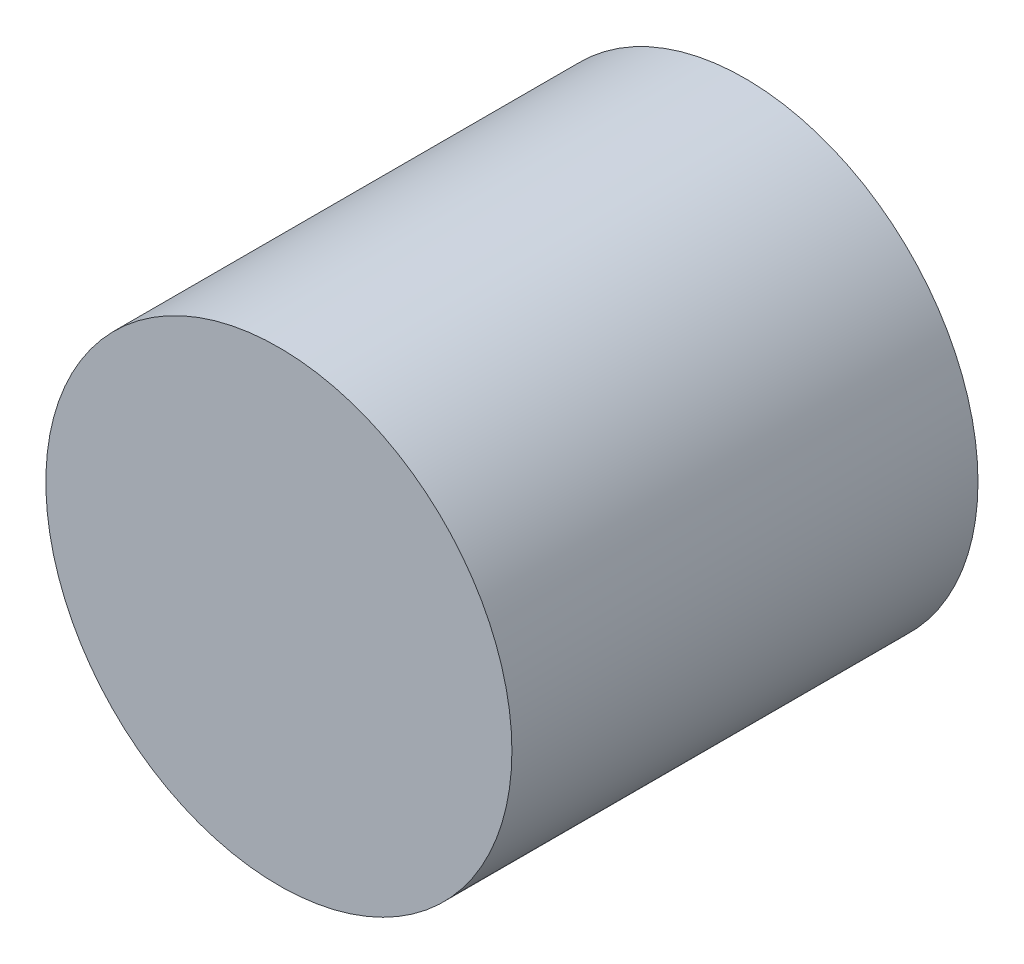
from build123d import *

# Parameters (mm, degrees)
SCHIZZO1_R                   = 60
ESTRUSIONE_ESTRUSIONE1_DEPTH = 120


with BuildPart() as part:
    # Schizzo1 → Estrusione-Estrusione1 (new body)
    with BuildSketch(Plane.XY):
        Circle(SCHIZZO1_R)
    extrude(amount=ESTRUSIONE_ESTRUSIONE1_DEPTH)


solid = part.part
